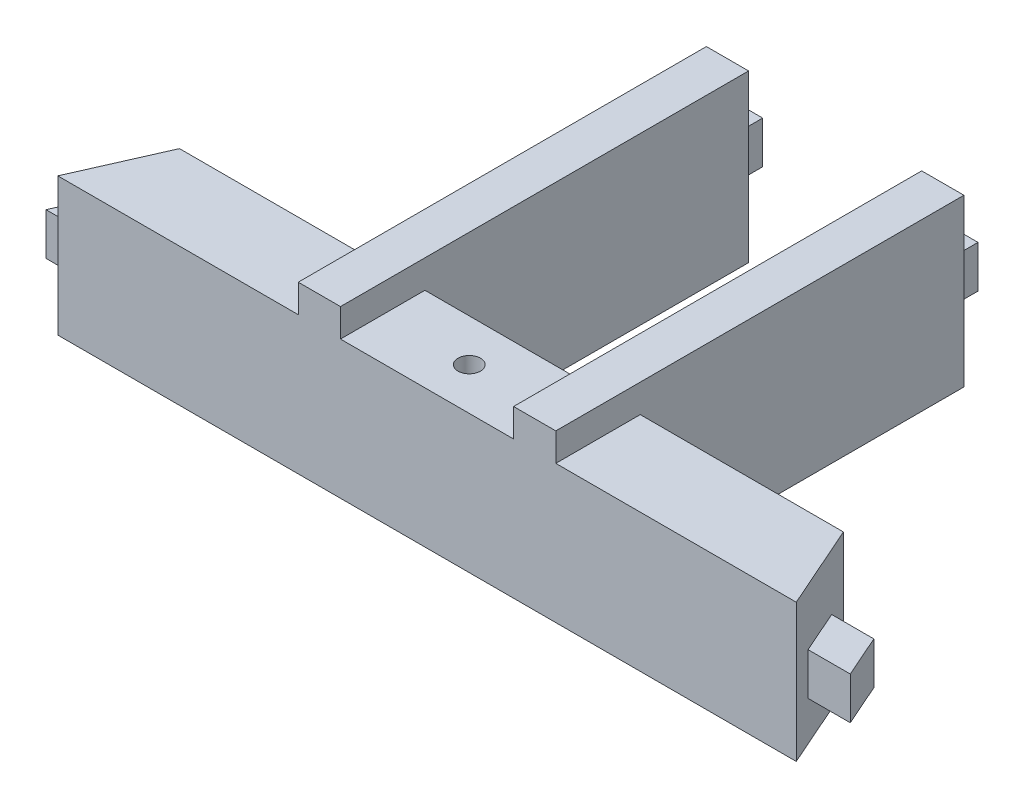
from build123d import *

# Parameters (mm, degrees)
SKETCH1_W                = 58
SKETCH1_H                = 65
BOSS_EXTRUDE1_DEPTH      = 30
BOSS_EXTRUDE3_REACH      = 92.09
SKETCH10_W               = 5
SKETCH10_H               = 14
CUT_EXTRUDE1_REACH       = 111.372
SKETCH2_R                = 2.45
SKETCH2_R_2              = 2.55
CUT_EXTRUDE2_REACH       = 91.744
SKETCH3_W                = 12.4
SKETCH3_H                = 10.4
SKETCH11_W               = 3
SKETCH11_H               = 2
BOSS_EXTRUDE4_DEPTH      = 6.3
FILLET3_R                = 1.5
SKETCH12_R               = 0.5
CUT_EXTRUDE3_DEPTH       = 92.15338732
FILLET3_OF_MIRROR1_R     = 1.5
BOSS_EXTRUDE5_REACH      = 111.564
SKETCH13_W               = 15
SKETCH13_H               = 6
BOSS_EXTRUDE6_REACH      = 111.564
SKETCH17_W               = 15
SKETCH17_H               = 14
CUT_EXTRUDE18_REACH      = 129.651
SKETCH35_W               = 16
SKETCH35_H               = 6
FILLET5_R                = 3
BOSS_EXTRUDE7_START      = 20.2
BOSS_EXTRUDE7_DEPTH      = 9.8
BOSS_EXTRUDE8_DEPTH      = 20
CUT_EXTRUDE15_REACH      = 95.637
SKETCH28_R               = 0.8
FILLET4_R                = 3
CUT_EXTRUDE16_REACH      = 96.767
SKETCH29_R               = 1.6
SKETCH30_W               = 14
SKETCH30_H               = 1.5
BOSS_EXTRUDE9_DEPTH      = 6.1
SKETCH31_W               = 1.3
SKETCH31_H               = 14
BOSS_EXTRUDE10_DEPTH     = 5
CUT_EXTRUDE17_REACH      = 99.736
FILLET11_R               = 1
FILLET11_OF_MIRROR4_R    = 1
MIRROR5_START            = 2.5
MIRROR5_OUTLINE_W        = 1.5
MIRROR5_OUTLINE_H        = 14
MIRROR5_DEPTH            = 6.1
MIRROR5_START_2          = 7.3
MIRROR5_2_DEPTH          = 1.3
SKETCH36_W               = 22.4
SKETCH36_H               = 14.8
BOSS_EXTRUDE12_DEPTH     = 14
CUT_EXTRUDE19_DEPTH      = 3
CUT_EXTRUDE20_DEPTH      = 11
CUT_EXTRUDE21_REACH      = 101.088
SKETCH41_W               = 3
SKETCH41_H               = 35
BOSS_EXTRUDE13_DEPTH     = 2
BOSS_EXTRUDE14_START     = -1.789079
SKETCH43_W               = 36.284482562
SKETCH43_H               = 9.6
BOSS_EXTRUDE14_DEPTH     = 66.789079
BOSS_EXTRUDE15_REACH     = 152.996
SKETCH44_W               = 2.842240903
SKETCH44_H               = 50
FILLET6_R                = 8
FILLET7_R                = 5
SKETCH45_W               = 17
SKETCH45_H               = 8
CUT_EXTRUDE22_DEPTH      = 166.644015889
BOSS_EXTRUDE16_REACH     = 152.29
SKETCH46_W               = 4.5
SKETCH46_H               = 5
BOSS_EXTRUDE17_REACH     = 154.715
SKETCH49_W               = 8
SKETCH49_H               = 9
CUT_EXTRUDE23_DEPTH      = 8
SKETCH50_R               = 2.45
CUT_EXTRUDE24_DEPTH      = 4.5
CUT_EXTRUDE25_START      = 13.5
SKETCH51_R               = 2.45
CUT_EXTRUDE25_DEPTH      = 4.5
BOSS_EXTRUDE18_REACH     = 165.708
SKETCH53_W               = 5
SKETCH53_H               = 10
SKETCH55_W               = 58
SKETCH55_H               = 10
BOSS_EXTRUDE20_DEPTH     = 4
CUT_EXTRUDE9_START       = -10
SKETCH19_W               = 30
SKETCH19_H               = 15
CUT_EXTRUDE9_DEPTH       = 10
SKETCH58_W               = 70
SKETCH58_H               = 9
CUT_EXTRUDE27_DEPTH      = 153.77843439
BOSS_EXTRUDE22_REACH     = 153.411
SKETCH59_W               = 30
SKETCH59_H               = 5
CUT_EXTRUDE28_REACH      = 183.113
SKETCH18_R               = 1.5
FILLET9_R                = 2
FILLET10_R               = 1
SKETCH60_W               = 70
SKETCH60_H               = 3
BOSS_EXTRUDE23_DEPTH     = 30
CUT_EXTRUDE29_DEPTH      = 7.5
CUT_EXTRUDE30_DEPTH      = 3
SKETCH64_W               = 58
SKETCH64_H               = 4
BOSS_EXTRUDE24_DEPTH     = 6
CUT_EXTRUDE31_DEPTH      = 7.5
CUT_EXTRUDE32_DEPTH      = 153.77843439
SKETCH66_W               = 26.284482562
SKETCH66_H               = 4.8
BOSS_EXTRUDE25_DEPTH     = 10
SKETCH73_W               = 121.646596119
SKETCH73_H               = 145.231140265
CUT_EXTRUDE33_DEPTH      = 16
CUT_EXTRUDE34_DEPTH      = 4
CUT_EXTRUDE35_DEPTH      = 6.5
CUT_EXTRUDE36_DEPTH      = 7
SKETCH79_W               = 43.755200993
SKETCH79_H               = 6.87148653
CUT_EXTRUDE37_DEPTH      = 2
CUT_EXTRUDE38_DEPTH      = 2.4
CUT_EXTRUDE39_DEPTH      = 108.707547785
CUT_EXTRUDE39_DEPTH_BACK = 108.707547785
SKETCH81_W               = 95.744118352
SKETCH81_H               = 138.331599567
BOSS_EXTRUDE26_START     = -2.8
BOSS_EXTRUDE26_DEPTH     = 3
SKETCH83_W               = 1
SKETCH83_H               = 3
BOSS_EXTRUDE27_DEPTH     = 2


# Read off the part's stored shape, not the designer's step: Mirror5
# Some blends are built 0.0001 mm under size
with BuildPart() as part:
    # Sketch1 → Boss-Extrude1 (new body)
    with BuildSketch(Plane(origin=(0, 0, 0), x_dir=(1, 0, 0), z_dir=(0, 1, 0))):
        Polygon((-35, 38.5), (-17.352941176, 78.5), (17.352941947, 78.5), (35, 38.5), (35, -38.5), (-35, -38.5), align=None)
        Rectangle(SKETCH1_W, SKETCH1_H, mode=Mode.SUBTRACT)
        Polygon((-28.44203382, 38.5), (28.442033867, 38.5), (13.442034522, 72.5), (-13.44203382, 72.5), align=None, mode=Mode.SUBTRACT)
    extrude(amount=BOSS_EXTRUDE1_DEPTH)

    # Sketch7 → Loft3 section 0
    with BuildSketch(Plane.XY.offset(-32.5)):
        with BuildLine():
            Line((-8.6, 30), (8.6, 30))
            Line((8.6, 30), (8.6, 27))
            Line((8.6, 27), (-8.6, 27))
            Line((-8.6, 27), (-8.6, 30))
        make_face()
    # Sketch8 → Loft3 section 1
    with BuildSketch(Plane.XY.offset(38.5)):
        with BuildLine():
            Line((-8.6, 30), (8.6, 30))
            Line((8.6, 30), (8.6, 27))
            Line((8.6, 27), (-8.6, 27))
            Line((-8.6, 27), (-8.6, 30))
        make_face()
    loft3 = loft()

    # Mirror3: Loft3 across plane
    add(loft3.mirror(Plane(origin=(0, 15, 0), x_dir=(0, 0, 1), z_dir=(0, -1, 0))))

    # Sketch10 → Boss-Extrude3 (add, up to next)
    with BuildSketch(Plane.XZ.offset(-27), mode=Mode.PRIVATE) as boss_extrude3_sk1:
        with Locations((0, 2.5)):
            Rectangle(SKETCH10_W, SKETCH10_H)
    boss_extrude3_tool1 = extrude(boss_extrude3_sk1.sketch, amount=BOSS_EXTRUDE3_REACH, mode=Mode.PRIVATE) - part.part
    add(boss_extrude3_tool1.solids().sort_by_distance((0, 27, 2.5))[0])

    # Sketch2 → Cut-Extrude1 (cut, up to next)
    with BuildSketch(Plane(origin=(35, 0, 0), x_dir=(0, 0, -1), z_dir=(1, 0, 0)), mode=Mode.PRIVATE) as cut_extrude1_sk1:
        with Locations((-2.5, 15)):
            Circle(SKETCH2_R)
    cut_extrude1_tool1 = extrude(cut_extrude1_sk1.sketch, amount=-CUT_EXTRUDE1_REACH, mode=Mode.PRIVATE) & part.part
    # Sketch2 → Cut-Extrude1 (cut, up to next)
    with BuildSketch(Plane(origin=(35, 0, 0), x_dir=(0, 0, -1), z_dir=(1, 0, 0)), mode=Mode.PRIVATE) as cut_extrude1_sk2:
        with Locations((19.5, 15)):
            Circle(SKETCH2_R_2)
    cut_extrude1_tool2 = extrude(cut_extrude1_sk2.sketch, amount=-CUT_EXTRUDE1_REACH, mode=Mode.PRIVATE) & part.part
    cut_extrude1_1 = cut_extrude1_tool1.solids().sort_by_distance((35, 15, 2.5))[0]
    add(cut_extrude1_1, mode=Mode.SUBTRACT)
    cut_extrude1_2 = cut_extrude1_tool2.solids().sort_by_distance((35, 15, -19.5))[0]
    add(cut_extrude1_2, mode=Mode.SUBTRACT)
    cut_extrude1 = cut_extrude1_1 + cut_extrude1_2  # Cut-Extrude1 as one shape, for the pattern or mirror that repeats it

    # Sketch3 → Cut-Extrude2 (cut, up to next)
    with BuildSketch(Plane(origin=(0, 0, -38.5), x_dir=(-1, 0, 0), z_dir=(0, 0, -1)), mode=Mode.PRIVATE) as cut_extrude2_sk1:
        with Locations((0, 15)):
            Rectangle(SKETCH3_W, SKETCH3_H)
    cut_extrude2_tool1 = extrude(cut_extrude2_sk1.sketch, amount=-CUT_EXTRUDE2_REACH, mode=Mode.PRIVATE) & part.part
    add(cut_extrude2_tool1.solids().sort_by_distance((0, 15, -38.5))[0], mode=Mode.SUBTRACT)

    # Sketch11 → Boss-Extrude4 (add)
    with BuildSketch(Plane(origin=(35, 0, 0), x_dir=(0, 0, -1), z_dir=(1, 0, 0))):
        with Locations((2.5, 20)):
            Rectangle(SKETCH11_W, SKETCH11_H)
        with Locations((2.5, 10)):
            Rectangle(SKETCH11_W, SKETCH11_H)
    boss_extrude4 = extrude(amount=BOSS_EXTRUDE4_DEPTH)

    # Fillet3
    fillet3_edges = [part.edges().sort_by_distance(p)[0] for p in [
        (41.3, 10, -1),
        (41.3, 10, -4),
        (41.3, 20, -1),
        (41.3, 20, -4),
    ]]
    fillet(fillet3_edges, radius=FILLET3_R - 0.0001)  # a hair under: the kernel refuses the full size

    # Sketch12 → Cut-Extrude3 (cut, through all)
    with BuildSketch(Plane(origin=(0, 21, 0), x_dir=(1, 0, 0), z_dir=(0, 1, 0))):
        with Locations(Location((39.8, 2.5, 0), (0, 0, 270))):
            Circle(SKETCH12_R)
    cut_extrude3 = extrude(amount=-CUT_EXTRUDE3_DEPTH, mode=Mode.SUBTRACT)

    # Mirror1: Cut-Extrude1, Boss-Extrude4, Cut-Extrude3 across plane
    add(cut_extrude1.mirror(Plane(origin=(0, 0, 0), x_dir=(0, 0, 1), z_dir=(1, 0, 0))), mode=Mode.SUBTRACT)
    add(boss_extrude4.mirror(Plane(origin=(0, 0, 0), x_dir=(0, 0, 1), z_dir=(1, 0, 0))))
    add(cut_extrude3.mirror(Plane(origin=(0, 0, 0), x_dir=(0, 0, 1), z_dir=(1, 0, 0))), mode=Mode.SUBTRACT)

    # Fillet3 of Mirror1
    fillet3_of_mirror1_edges = [part.edges().sort_by_distance(p)[0] for p in [
        (-41.3, 10, -1),
        (-41.3, 10, -4),
        (-41.3, 20, -1),
        (-41.3, 20, -4),
    ]]
    fillet(fillet3_of_mirror1_edges, radius=FILLET3_OF_MIRROR1_R - 0.0001)  # a hair under: the kernel refuses the full size

    # Sketch13 → Boss-Extrude5 (add, up to next)
    with BuildSketch(Plane(origin=(-29, 0, 0), x_dir=(0, 0, -1), z_dir=(1, 0, 0)), mode=Mode.PRIVATE) as boss_extrude5_sk1:
        with Locations((-25, 27)):
            Rectangle(SKETCH13_W, SKETCH13_H)
    boss_extrude5_tool1 = extrude(boss_extrude5_sk1.sketch, amount=BOSS_EXTRUDE5_REACH, mode=Mode.PRIVATE) - part.part
    add(boss_extrude5_tool1.solids().sort_by_distance((-29, 27, 25))[0])

    # Sketch17 → Boss-Extrude6 (add, up to next)
    with BuildSketch(Plane(origin=(-29, 0, 0), x_dir=(0, 0, -1), z_dir=(1, 0, 0)), mode=Mode.PRIVATE) as boss_extrude6_sk1:
        with Locations((-25, 7)):
            Rectangle(SKETCH17_W, SKETCH17_H)
    boss_extrude6_tool1 = extrude(boss_extrude6_sk1.sketch, amount=BOSS_EXTRUDE6_REACH, mode=Mode.PRIVATE) - part.part
    add(boss_extrude6_tool1.solids().sort_by_distance((-29, 7, 25))[0])

    # Sketch35 → Cut-Extrude18 (cut, up to next)
    with BuildSketch(Plane(origin=(0, 0, -78.5), x_dir=(-1, 0, 0), z_dir=(0, 0, -1)), mode=Mode.PRIVATE) as cut_extrude18_sk1:
        with Locations((0, 15)):
            Rectangle(SKETCH35_W, SKETCH35_H)
    cut_extrude18_tool1 = extrude(cut_extrude18_sk1.sketch, amount=-CUT_EXTRUDE18_REACH, mode=Mode.PRIVATE) & part.part
    add(cut_extrude18_tool1.solids().sort_by_distance((0, 15, -78.5))[0], mode=Mode.SUBTRACT)

    # Fillet5
    fillet5_edges = [part.edges().sort_by_distance(p)[0] for p in [
        (-35, 15, -38.5),
        (-17.352941176, 15, -78.5),
        (17.352941947, 15, -78.5),
        (35, 15, -38.5),
        (-8, 15, -78.5),
        (8, 15, -78.5),
    ]]
    fillet(fillet5_edges, radius=FILLET5_R)

    # Sketch24 → Boss-Extrude7 (add)
    with BuildSketch(Plane(origin=(0, 0, 0), x_dir=(1, 0, 0), z_dir=(0, 1, 0)).offset(BOSS_EXTRUDE7_START)):
        Polygon((9.15, 49.5), (9.15, 72.5), (6.15, 72.5), (6.15, 49.5), (-6.15, 49.5), (-6.15, 72.5), (-9.15, 72.5), (-9.15, 49.5), (-23.589092644, 49.5), (-26.23615161, 43.5), (26.23615161, 43.5), (23.589092902, 49.5), align=None)
    extrude(amount=BOSS_EXTRUDE7_DEPTH)

    # Sketch26 → Boss-Extrude8 (add)
    with BuildSketch(Plane(origin=(0, 0, -38.5), x_dir=(-1, 0, 0), z_dir=(0, 0, -1))):
        Polygon((-11.2, 4.8), (-11.2, 0), (11.2, 0), (11.2, 4.8), (11.2, 14.8), (6.2, 14.8), (6.2, 9.8), (-6.2, 9.8), (-6.2, 14.8), (-11.2, 14.8), align=None)
    extrude(amount=BOSS_EXTRUDE8_DEPTH)

    # Sketch28 → Cut-Extrude15 (cut, up to next)
    with BuildSketch(Plane(origin=(0, 30, 0), x_dir=(-1, 0, 0), z_dir=(0, 1, 0)), mode=Mode.PRIVATE) as cut_extrude15_sk1:
        with Locations(Location((0, -46.5, 0), (0, 0, 90))):
            Circle(SKETCH28_R)
    cut_extrude15_tool1 = extrude(cut_extrude15_sk1.sketch, amount=-CUT_EXTRUDE15_REACH, mode=Mode.PRIVATE) & part.part
    # Sketch28 → Cut-Extrude15 (cut, up to next)
    with BuildSketch(Plane(origin=(0, 30, 0), x_dir=(-1, 0, 0), z_dir=(0, 1, 0)), mode=Mode.PRIVATE) as cut_extrude15_sk2:
        with Locations(Location((0, -75.5, 0), (0, 0, 90))):
            Circle(SKETCH28_R)
    cut_extrude15_tool2 = extrude(cut_extrude15_sk2.sketch, amount=-CUT_EXTRUDE15_REACH, mode=Mode.PRIVATE) & part.part
    add(cut_extrude15_tool1.solids().sort_by_distance((0, 30, -46.5))[0], mode=Mode.SUBTRACT)
    add(cut_extrude15_tool2.solids().sort_by_distance((0, 30, -75.5))[0], mode=Mode.SUBTRACT)

    # Fillet4
    fillet4_edges = [part.edges().sort_by_distance(p)[0] for p in [
        (35, 19, -2.5),
        (35, 20, -4),
        (35, 21, -2.5),
        (35, 11, -2.5),
        (35, 9, -2.5),
        (35, 10, -4),
        (-35, 19, -2.5),
        (-35, 20, -4),
        (-35, 21, -2.5),
        (-35, 11, -2.5),
        (-35, 9, -2.5),
        (-35, 10, -4),
    ]]
    fillet(fillet4_edges, radius=FILLET4_R)

    # Sketch29 → Cut-Extrude16 (cut, up to next)
    with BuildSketch(Plane(origin=(2.5, 0, 0), x_dir=(0, 0, -1), z_dir=(1, 0, 0)), mode=Mode.PRIVATE) as cut_extrude16_sk1:
        with Locations(Location((-2.5, 15, 0), (0, 0, 90))):
            Circle(SKETCH29_R)
    cut_extrude16_tool1 = extrude(cut_extrude16_sk1.sketch, amount=-CUT_EXTRUDE16_REACH, mode=Mode.PRIVATE) & part.part
    add(cut_extrude16_tool1.solids().sort_by_distance((2.5, 15, 2.5))[0], mode=Mode.SUBTRACT)

    # Sketch30 → Boss-Extrude9 (add)
    with BuildSketch(Plane.ZY.offset(2.5)):
        with Locations((2.5, 26.25)):
            Rectangle(SKETCH30_W, SKETCH30_H)
    boss_extrude9 = extrude(amount=BOSS_EXTRUDE9_DEPTH)

    # Sketch31 → Boss-Extrude10 (add)
    with BuildSketch(Plane.XZ.offset(-25.5)):
        with Locations((-7.95, 2.5)):
            Rectangle(SKETCH31_W, SKETCH31_H)
    boss_extrude10 = extrude(amount=BOSS_EXTRUDE10_DEPTH)

    # Sketch32 → Cut-Extrude17 (cut, up to next)
    with BuildSketch(Plane.ZY.offset(8.6), mode=Mode.PRIVATE) as cut_extrude17_sk1:
        with BuildLine():
            Line((-4.5, 20.5), (-4.5, 20.656854249))
            ThreePointArc((-4.5, 20.656854249), (2.5, 24), (9.5, 20.656854249))
            Line((9.5, 20.656854249), (9.5, 20.5))
            Line((9.5, 20.5), (-4.5, 20.5))
        make_face()
    cut_extrude17_tool1 = extrude(cut_extrude17_sk1.sketch, amount=-CUT_EXTRUDE17_REACH, mode=Mode.PRIVATE) & part.part
    cut_extrude17 = cut_extrude17_tool1.solids().sort_by_distance((-8.6, 21.927092, 2.5))[0]
    add(cut_extrude17, mode=Mode.SUBTRACT)

    # Fillet11
    fillet11_edges = [part.edges().sort_by_distance(p)[0] for p in [
        (-7.95, 20.656854249, 9.5),
        (-7.95, 20.656854249, -4.5),
    ]]
    fillet(fillet11_edges, radius=FILLET11_R)

    # Mirror4: Boss-Extrude9, Boss-Extrude10, Cut-Extrude17 across plane
    add(boss_extrude9.mirror(Plane(origin=(0, 15, 0), x_dir=(0, 0, 1), z_dir=(0, -1, 0))))
    add(boss_extrude10.mirror(Plane(origin=(0, 15, 0), x_dir=(0, 0, 1), z_dir=(0, -1, 0))))
    add(cut_extrude17.mirror(Plane(origin=(0, 15, 0), x_dir=(0, 0, 1), z_dir=(0, -1, 0))), mode=Mode.SUBTRACT)

    # Fillet11 of Mirror4
    fillet11_of_mirror4_edges = [part.edges().sort_by_distance(p)[0] for p in [
        (-7.95, 9.343145751, 9.5),
        (-7.95, 9.343145751, -4.5),
    ]]
    fillet(fillet11_of_mirror4_edges, radius=FILLET11_OF_MIRROR4_R)

    # Mirror5 outline → Mirror5 (add)
    with BuildSketch(Plane.YZ.offset(MIRROR5_START)):
        with Locations((3.75, 2.5)):
            Rectangle(MIRROR5_OUTLINE_W, MIRROR5_OUTLINE_H)
        with Locations((26.25, 2.5)):
            Rectangle(MIRROR5_OUTLINE_W, MIRROR5_OUTLINE_H)
    extrude(amount=MIRROR5_DEPTH)

    # Mirror5 2 outline → Mirror5 2 (add)
    with BuildSketch(Plane.YZ.offset(MIRROR5_START_2)):
        with BuildLine():
            Line((7, 9.5), (4.5, 9.5))
            Line((4.5, 9.5), (4.5, -4.5))
            Line((4.5, -4.5), (7, -4.5))
            ThreePointArc((7, -4.5), (7.894427191, -3.947213595), (7.8, -2.9))
            ThreePointArc((7.8, -2.9), (6, 2.5), (7.8, 7.9))
            ThreePointArc((7.8, 7.9), (7.894427191, 8.947213595), (7, 9.5))
        make_face()
        with BuildLine():
            Line((25.5, 9.5), (23, 9.5))
            ThreePointArc((23, 9.5), (22.105572809, 8.947213595), (22.2, 7.9))
            ThreePointArc((22.2, 7.9), (24, 2.5), (22.2, -2.9))
            ThreePointArc((22.2, -2.9), (22.105572809, -3.947213595), (23, -4.5))
            Line((23, -4.5), (25.5, -4.5))
            Line((25.5, -4.5), (25.5, 9.5))
        make_face()
    extrude(amount=MIRROR5_2_DEPTH)

    # Sketch36 → Boss-Extrude12 (add)
    with BuildSketch(Plane(origin=(0, 0, -58.5), x_dir=(-1, 0, 0), z_dir=(0, 0, -1))):
        with Locations((0, 7.4)):
            Rectangle(SKETCH36_W, SKETCH36_H)
    extrude(amount=BOSS_EXTRUDE12_DEPTH)

    # Sketch37 → Cut-Extrude19 (cut)
    with BuildSketch(Plane.XY.offset(-58.5)):
        with BuildLine():
            Line((-6, 14.8), (6, 14.8))
            ThreePointArc((6, 14.8), (5.340169944, 12.004915028), (3.5, 9.8))
            Line((3.5, 9.8), (-3.5, 9.8))
            ThreePointArc((-3.5, 9.8), (-5.340169944, 12.004915028), (-6, 14.8))
        make_face()
    extrude(amount=-CUT_EXTRUDE19_DEPTH, mode=Mode.SUBTRACT)

    # Sketch38 → Cut-Extrude20 (cut)
    with BuildSketch(Plane.XY.offset(-61.5)):
        with BuildLine():
            Line((-6, 14.8), (6, 14.8))
            ThreePointArc((6, 14.8), (0, 11.8), (-6, 14.8))
        make_face()
    extrude(amount=-CUT_EXTRUDE20_DEPTH, mode=Mode.SUBTRACT)

    # Cut-Extrude21: up to this face of the body (flat: up to its plane)
    cut_extrude21_end = Plane(part.part.faces().sort_by_distance((11.2, 7.4, -55.5))[0])
    # Sketch40 → Cut-Extrude21 (cut, up to the picked face)
    with BuildSketch(Plane.ZY.offset(11.2), mode=Mode.PRIVATE) as cut_extrude21_sk1:
        Polygon((-58.5, 14.8), (-72.5, 14.8), (-72.5, 11.8), align=None)
    cut_extrude21_tool1 = split(extrude(cut_extrude21_sk1.sketch, amount=-CUT_EXTRUDE21_REACH, mode=Mode.PRIVATE), bisect_by=cut_extrude21_end, keep=Keep.BOTH, mode=Mode.PRIVATE)
    add(cut_extrude21_tool1.solids().sort_by(Axis((-11.2, 13.8, -67.833333), (1, 0, 0)))[0], mode=Mode.SUBTRACT)

    # Sketch41 → Boss-Extrude13 (add)
    with BuildSketch(Plane(origin=(0, 30, 0), x_dir=(1, 0, 0), z_dir=(0, 1, 0))):
        with Locations((-7.65, 61)):
            Rectangle(SKETCH41_W, SKETCH41_H)
        with Locations((7.65, 61)):
            Rectangle(SKETCH41_W, SKETCH41_H)
    extrude(amount=BOSS_EXTRUDE13_DEPTH)

    # Sketch43 → Boss-Extrude14 (add)
    with BuildSketch(Plane(origin=(0, 0, -78.5), x_dir=(-1, 0, 0), z_dir=(0, 0, -1)).offset(BOSS_EXTRUDE14_START)):
        with Locations((-3.78e-07, 4.8)):
            Rectangle(SKETCH43_W, SKETCH43_H)
        with Locations((-3.78e-07, 25.2)):
            Rectangle(SKETCH43_W, SKETCH43_H)
    extrude(amount=BOSS_EXTRUDE14_DEPTH)

    # Sketch44 → Boss-Extrude15 (add, up to next)
    with BuildSketch(Plane(origin=(0, 9.6, 0), x_dir=(1, 0, 0), z_dir=(0, 1, 0)), mode=Mode.PRIVATE) as boss_extrude15_sk1:
        with Locations((-16.721120451, 118.5)):
            Rectangle(SKETCH44_W, SKETCH44_H)
    boss_extrude15_tool1 = extrude(boss_extrude15_sk1.sketch, amount=BOSS_EXTRUDE15_REACH, mode=Mode.PRIVATE) - part.part
    # Sketch44 → Boss-Extrude15 (add, up to next)
    with BuildSketch(Plane(origin=(0, 9.6, 0), x_dir=(1, 0, 0), z_dir=(0, 1, 0)), mode=Mode.PRIVATE) as boss_extrude15_sk2:
        Polygon((18.142241659, 143.5), (15.3, 143.5), (15.3, 93.5), (18.142240903, 93.5), align=None)
    boss_extrude15_tool2 = extrude(boss_extrude15_sk2.sketch, amount=BOSS_EXTRUDE15_REACH, mode=Mode.PRIVATE) - part.part
    add(boss_extrude15_tool1.solids().sort_by_distance((-16.72112, 9.6, -118.5))[0])
    add(boss_extrude15_tool2.solids().sort_by_distance((16.721121, 9.6, -118.500001))[0])

    # Fillet6
    fillet6_edges = [part.edges().sort_by_distance(p)[0] for p in [
        (3.78e-07, 0, -143.5),
        (3.78e-07, 30, -143.5),
    ]]
    fillet(fillet6_edges, radius=FILLET6_R)

    # Fillet7
    # the kernel refuses this fillet: 5 mm, written as the material it takes off along each edge
    with BuildSketch(Plane(origin=(18.142241659, 0, -64.210921), x_dir=(-1, 0, 0), z_dir=(0, 0, -1))) as fillet7_piece_1_section:
        with BuildLine():
            CenterArc((FILLET7_R, FILLET7_R), FILLET7_R, 180, 90)
            Line((0, FILLET7_R), (0, 0))
            Line((0, 0), (FILLET7_R, 0))
        make_face()
    fillet7_piece_1 = extrude(amount=71.289079, mode=Mode.PRIVATE)
    fillet7_piece_1 = split(fillet7_piece_1, bisect_by=Plane(origin=(6.655944686, 1.159648817, -102.746528186), z_dir=(0.9149178080838143, 0, -0.4036401918182936)), keep=Keep.TOP, mode=Mode.PRIVATE)
    with BuildSketch(Plane(origin=(18.142241659, 8, -135.5), x_dir=(0, -1, 0), z_dir=(0, 0, 1))) as fillet7_piece_2:
        with BuildLine():
            CenterArc((8 - FILLET7_R, -FILLET7_R), FILLET7_R, 0, 90)
            Line((8 - FILLET7_R, 0), (8, 0))
            Line((8, 0), (8, -FILLET7_R))
        make_face()
    fillet7_piece_2_solid = revolve(axis=Axis((18.142241659, 8, -135.5), (1, 0, 0)), revolution_arc=90, mode=Mode.PRIVATE)
    with BuildSketch(Plane(origin=(18.142241659, 9.6, -143.5), x_dir=(-1, 0, 0), z_dir=(0, 1, 0))) as fillet7_piece_3:
        with BuildLine():
            CenterArc((FILLET7_R * 1.00000001512, FILLET7_R), FILLET7_R, 179.999999134, 90.000000866)
            Line((FILLET7_R * 1.511713279e-08, FILLET7_R * 1.00000001512), (0, 0))
            Line((0, 0), (FILLET7_R * 1.00000001512, 0))
        make_face()
    fillet7_piece_3_solid = extrude(amount=10.8, mode=Mode.PRIVATE)
    with BuildSketch(Plane(origin=(18.142241659, 22, -135.5), x_dir=(0, 1, 0), z_dir=(0, 0, 1))) as fillet7_piece_4:
        with BuildLine():
            CenterArc((8 - FILLET7_R, FILLET7_R), FILLET7_R, 270, 90)
            Line((8 - FILLET7_R, 0), (8, 0))
            Line((8, 0), (8, FILLET7_R))
        make_face()
    fillet7_piece_4_solid = revolve(axis=Axis((18.142241659, 22, -135.5), (-1, 0, 0)), revolution_arc=90, mode=Mode.PRIVATE)
    with BuildSketch(Plane(origin=(-18.142240903, 0, -64.210921), x_dir=(0, 1, 0), z_dir=(0, 0, -1))) as fillet7_piece_5_section:
        with BuildLine():
            CenterArc((FILLET7_R, FILLET7_R), FILLET7_R, 180, 90)
            Line((0, FILLET7_R), (0, 0))
            Line((0, 0), (FILLET7_R, 0))
        make_face()
    fillet7_piece_5 = extrude(amount=71.289079, mode=Mode.PRIVATE)
    fillet7_piece_5 = split(fillet7_piece_5, bisect_by=Plane(origin=(-6.655943611, 1.159648816, -102.746527816), z_dir=(-0.914917801572932, 0, -0.40364020657629374)), keep=Keep.TOP, mode=Mode.PRIVATE)
    with BuildSketch(Plane(origin=(-18.142240903, 8, -135.5), x_dir=(0, -1, 0), z_dir=(0, 0, 1))) as fillet7_piece_6:
        with BuildLine():
            CenterArc((8 - FILLET7_R, FILLET7_R), FILLET7_R, 270, 90)
            Line((8, FILLET7_R), (8, 0))
            Line((8, 0), (8 - FILLET7_R, 0))
        make_face()
    fillet7_piece_6_solid = revolve(axis=Axis((-18.142240903, 8, -135.5), (1, 0, 0)), revolution_arc=90, mode=Mode.PRIVATE)
    with BuildSketch(Plane(origin=(-18.142240903, 22, -143.5), x_dir=(0, 0, 1), z_dir=(0, -1, 0))) as fillet7_piece_7:
        with BuildLine():
            CenterArc((FILLET7_R, -FILLET7_R), FILLET7_R, 90, 90)
            Line((0, -FILLET7_R), (0, 0))
            Line((0, 0), (FILLET7_R, 0))
        make_face()
    fillet7_piece_7_solid = extrude(amount=14, mode=Mode.PRIVATE)
    with BuildSketch(Plane(origin=(-18.142240903, 22, -135.5), x_dir=(0, 1, 0), z_dir=(0, 0, 1))) as fillet7_piece_8:
        with BuildLine():
            CenterArc((8 - FILLET7_R, -FILLET7_R), FILLET7_R, 0, 90)
            Line((8, -FILLET7_R), (8, 0))
            Line((8, 0), (8 - FILLET7_R, 0))
        make_face()
    fillet7_piece_8_solid = revolve(axis=Axis((-18.142240903, 22, -135.5), (-1, 0, 0)), revolution_arc=90, mode=Mode.PRIVATE)
    with BuildSketch(Plane(origin=(18.142241659, 30, -64.210921), x_dir=(-1, 0, 0), z_dir=(0, 0, -1))) as fillet7_piece_9_section:
        with BuildLine():
            CenterArc((FILLET7_R, -FILLET7_R), FILLET7_R, 90, 90)
            Line((0, -FILLET7_R), (0, 0))
            Line((0, 0), (FILLET7_R, 0))
        make_face()
    fillet7_piece_9 = extrude(amount=71.289079, mode=Mode.PRIVATE)
    fillet7_piece_9 = split(fillet7_piece_9, bisect_by=Plane(origin=(6.655944686, 28.840351183, -102.746528186), z_dir=(0.9149178080838143, 0, -0.4036401918182936)), keep=Keep.TOP, mode=Mode.PRIVATE)
    with BuildSketch(Plane(origin=(-18.142240903, 30, -64.210921), x_dir=(1, 0, 0), z_dir=(0, 0, -1))) as fillet7_piece_10_section:
        with BuildLine():
            CenterArc((FILLET7_R, FILLET7_R), FILLET7_R, 180, 90)
            Line((0, FILLET7_R), (0, 0))
            Line((0, 0), (FILLET7_R, 0))
        make_face()
    fillet7_piece_10 = extrude(amount=71.289079, mode=Mode.PRIVATE)
    fillet7_piece_10 = split(fillet7_piece_10, bisect_by=Plane(origin=(-6.655943611, 28.840351184, -102.746527816), z_dir=(-0.914917801572932, 0, -0.40364020657629374)), keep=Keep.TOP, mode=Mode.PRIVATE)
    with BuildSketch(Plane(origin=(18.142241659, 20.4, -143.5), x_dir=(0, 0, 1), z_dir=(0, 1, 0)), Plane(origin=(18.142241659, 9.6, -143.5), x_dir=(-1, 0, 0), z_dir=(0, -1, 0))) as fillet7_piece_11:
        with BuildLine():
            CenterArc((FILLET7_R, -FILLET7_R), FILLET7_R, 90, 90)
            Line((0, -FILLET7_R), (0, 0))
            Line((0, 0), (FILLET7_R, 0))
        make_face()
    fillet7_piece_11_solid = extrude(amount=1.6, mode=Mode.PRIVATE)
    add([fillet7_piece_1, fillet7_piece_2_solid, fillet7_piece_3_solid, fillet7_piece_4_solid, fillet7_piece_5, fillet7_piece_6_solid, fillet7_piece_7_solid, fillet7_piece_8_solid, fillet7_piece_9, fillet7_piece_10, fillet7_piece_11_solid], mode=Mode.SUBTRACT)

    # Sketch45 → Cut-Extrude22 (cut, through all)
    with BuildSketch(Plane(origin=(35, 0, 0), x_dir=(0, 0, -1), z_dir=(1, 0, 0))):
        with Locations((-24, 19)):
            Rectangle(SKETCH45_W, SKETCH45_H)
    extrude(amount=-CUT_EXTRUDE22_DEPTH, mode=Mode.SUBTRACT)

    # Sketch46 → Boss-Extrude16 (add, up to next)
    with BuildSketch(Plane(origin=(0, 15, 0), x_dir=(1, 0, 0), z_dir=(0, 1, 0)), mode=Mode.PRIVATE) as boss_extrude16_sk1:
        with Locations((31.25, -30)):
            Rectangle(SKETCH46_W, SKETCH46_H)
    boss_extrude16_tool1 = extrude(boss_extrude16_sk1.sketch, amount=BOSS_EXTRUDE16_REACH, mode=Mode.PRIVATE) - part.part
    boss_extrude16 = boss_extrude16_tool1.solids().sort_by_distance((31.25, 15, 30))[0]
    add(boss_extrude16)

    # Boss-Extrude17: up to this face of the body (flat: up to its plane)
    boss_extrude17_end = Plane(part.part.faces().sort_by_distance((-6.013146063, 30, -46.5))[0])
    # Sketch48 → Boss-Extrude17 (add, up to the picked face)
    with BuildSketch(Plane.XZ, mode=Mode.PRIVATE) as boss_extrude17_sk1:
        with BuildLine():
            Line((35, 29.5), (39, 29.5))
            ThreePointArc((39, 29.5), (43, 25.5), (39, 21.5))
            Line((39, 21.5), (35, 21.5))
            Line((35, 21.5), (35, 29.5))
        make_face()
    boss_extrude17_tool1 = split(extrude(boss_extrude17_sk1.sketch, amount=-BOSS_EXTRUDE17_REACH, mode=Mode.PRIVATE), bisect_by=boss_extrude17_end, keep=Keep.BOTH, mode=Mode.PRIVATE)
    boss_extrude17 = boss_extrude17_tool1.solids().sort_by(Axis((38.626601, 0, 25.5), (0, 1, 0)))[0]
    add(boss_extrude17)

    # Sketch49 → Cut-Extrude23 (cut)
    with BuildSketch(Plane.XY.offset(29.5)):
        with Locations((39, 19)):
            Rectangle(SKETCH49_W, SKETCH49_H)
    cut_extrude23 = extrude(amount=-CUT_EXTRUDE23_DEPTH, mode=Mode.SUBTRACT)

    # Sketch50 → Cut-Extrude24 (cut)
    with BuildSketch(Plane(origin=(0, 14.5, 0), x_dir=(1, 0, 0), z_dir=(0, 1, 0))):
        with Locations(Location((39, -25.5, 0), (0, 0, 270))):
            Circle(SKETCH50_R)
    cut_extrude24 = extrude(amount=-CUT_EXTRUDE24_DEPTH, mode=Mode.SUBTRACT)

    # Sketch51 → Cut-Extrude25 (cut)
    with BuildSketch(Plane(origin=(0, 14.5, 0), x_dir=(1, 0, 0), z_dir=(0, 1, 0)).offset(CUT_EXTRUDE25_START)):
        with Locations(Location((39, -25.5, 0), (0, 0, 270))):
            Circle(SKETCH51_R)
    cut_extrude25 = extrude(amount=-CUT_EXTRUDE25_DEPTH, mode=Mode.SUBTRACT)

    # Mirror7: Boss-Extrude16, Boss-Extrude17, Cut-Extrude23, Cut-Extrude24, Cut-Extrude25 across plane
    add(boss_extrude16.mirror(Plane(origin=(0, 0, 0), x_dir=(0, 0, 1), z_dir=(1, 0, 0))))
    add(boss_extrude17.mirror(Plane(origin=(0, 0, 0), x_dir=(0, 0, 1), z_dir=(1, 0, 0))))
    add(cut_extrude23.mirror(Plane(origin=(0, 0, 0), x_dir=(0, 0, 1), z_dir=(1, 0, 0))), mode=Mode.SUBTRACT)
    add(cut_extrude24.mirror(Plane(origin=(0, 0, 0), x_dir=(0, 0, 1), z_dir=(1, 0, 0))), mode=Mode.SUBTRACT)
    add(cut_extrude25.mirror(Plane(origin=(0, 0, 0), x_dir=(0, 0, 1), z_dir=(1, 0, 0))), mode=Mode.SUBTRACT)

    # Sketch53 → Boss-Extrude18 (add, up to next)
    with BuildSketch(Plane.ZY.offset(-29), mode=Mode.PRIVATE) as boss_extrude18_sk1:
        with Locations((30, 19)):
            Rectangle(SKETCH53_W, SKETCH53_H)
    boss_extrude18_tool1 = extrude(boss_extrude18_sk1.sketch, amount=BOSS_EXTRUDE18_REACH, mode=Mode.PRIVATE) - part.part
    add(boss_extrude18_tool1.solids().sort_by_distance((29, 19, 30))[0])

    # Sketch55 → Boss-Extrude20 (add)
    with BuildSketch(Plane(origin=(0, 0, 27.5), x_dir=(-1, 0, 0), z_dir=(0, 0, -1))):
        with Locations((0, 19)):
            Rectangle(SKETCH55_W, SKETCH55_H)
    extrude(amount=BOSS_EXTRUDE20_DEPTH)

    # Sketch19 → Cut-Extrude9 (cut)
    with BuildSketch(Plane(origin=(0, 30, 0), x_dir=(1, 0, 0), z_dir=(0, 1, 0)).offset(CUT_EXTRUDE9_START)):
        with Locations((0, -25)):
            Rectangle(SKETCH19_W, SKETCH19_H)
    extrude(amount=-CUT_EXTRUDE9_DEPTH, mode=Mode.SUBTRACT)

    # Sketch58 → Cut-Extrude27 (cut, through all)
    with BuildSketch(Plane(origin=(0, 30, 0), x_dir=(1, 0, 0), z_dir=(0, 1, 0))):
        with Locations((0, -34)):
            Rectangle(SKETCH58_W, SKETCH58_H)
    extrude(amount=-CUT_EXTRUDE27_DEPTH, mode=Mode.SUBTRACT)

    # Sketch59 → Boss-Extrude22 (add, up to next)
    with BuildSketch(Plane(origin=(0, 10, 0), x_dir=(1, 0, 0), z_dir=(0, 1, 0)), mode=Mode.PRIVATE) as boss_extrude22_sk1:
        with Locations((0, -27)):
            Rectangle(SKETCH59_W, SKETCH59_H)
    boss_extrude22_tool1 = extrude(boss_extrude22_sk1.sketch, amount=BOSS_EXTRUDE22_REACH, mode=Mode.PRIVATE) - part.part
    add(boss_extrude22_tool1.solids().sort_by_distance((0, 10, 27))[0])

    # Sketch18 → Cut-Extrude28 (cut, up to next)
    with BuildSketch(Plane.XY.offset(29.5), mode=Mode.PRIVATE) as cut_extrude28_sk1:
        with Locations((7.5, 15)):
            Circle(SKETCH18_R)
    cut_extrude28_tool1 = extrude(cut_extrude28_sk1.sketch, amount=-CUT_EXTRUDE28_REACH, mode=Mode.PRIVATE) & part.part
    # Sketch18 → Cut-Extrude28 (cut, up to next)
    with BuildSketch(Plane.XY.offset(29.5), mode=Mode.PRIVATE) as cut_extrude28_sk2:
        with Locations((-7.5, 15)):
            Circle(SKETCH18_R)
    cut_extrude28_tool2 = extrude(cut_extrude28_sk2.sketch, amount=-CUT_EXTRUDE28_REACH, mode=Mode.PRIVATE) & part.part
    add(cut_extrude28_tool1.solids().sort_by_distance((7.5, 15, 29.5))[0], mode=Mode.SUBTRACT)
    add(cut_extrude28_tool2.solids().sort_by_distance((-7.5, 15, 29.5))[0], mode=Mode.SUBTRACT)

    # Fillet9
    fillet9_edges = [part.edges().sort_by_distance(p)[0] for p in [
        (6, 15, 24.5),
        (-9, 15, 24.5),
    ]]
    fillet(fillet9_edges, radius=FILLET9_R)

    # Fillet10
    fillet10_edges = [part.edges().sort_by_distance(p)[0] for p in [
        (6, 15, 29.5),
        (-9, 15, 29.5),
    ]]
    fillet(fillet10_edges, radius=FILLET10_R)

    # Sketch60 → Boss-Extrude23 (add)
    with BuildSketch(Plane.XZ):
        with Locations((0, 31)):
            Rectangle(SKETCH60_W, SKETCH60_H)
    extrude(amount=-BOSS_EXTRUDE23_DEPTH)

    # Sketch61 → Cut-Extrude29 (cut)
    with BuildSketch(Plane.XZ):
        Polygon((11.5, 32.5), (-11.5, 32.5), (-14.5, 25), (14.5, 25), align=None)
    extrude(amount=-CUT_EXTRUDE29_DEPTH, mode=Mode.SUBTRACT)

    # Sketch62 → Cut-Extrude30 (cut)
    with BuildSketch(Plane.XY.offset(32.5)):
        with BuildLine():
            Line((-7.5, 17.5), (7.5, 17.5))
            ThreePointArc((7.5, 17.5), (10, 15), (7.5, 12.5))
            Line((7.5, 12.5), (-7.5, 12.5))
            ThreePointArc((-7.5, 12.5), (-10, 15), (-7.5, 17.5))
        make_face()
    extrude(amount=-CUT_EXTRUDE30_DEPTH, mode=Mode.SUBTRACT)

    # Sketch64 → Boss-Extrude24 (add)
    with BuildSketch(Plane(origin=(0, 0, 23.5), x_dir=(-1, 0, 0), z_dir=(0, 0, -1))):
        with Locations((0, 22)):
            Rectangle(SKETCH64_W, SKETCH64_H)
    extrude(amount=BOSS_EXTRUDE24_DEPTH)

    # Sketch63 → Cut-Extrude31 (cut)
    with BuildSketch(Plane(origin=(0, 30, 0), x_dir=(1, 0, 0), z_dir=(0, 1, 0))):
        Polygon((-11.5, -32.5), (11.5, -32.5), (14.5, -25), (-14.5, -25), align=None)
    extrude(amount=-CUT_EXTRUDE31_DEPTH, mode=Mode.SUBTRACT)

    # Sketch65 → Cut-Extrude32 (cut, through all)
    with BuildSketch(Plane(origin=(0, 30, 0), x_dir=(1, 0, 0), z_dir=(0, 1, 0))):
        Polygon((-13.142240903, 88.044253953), (13.142241659, 88.044254404), (18.142241659, 76.710920576), (18.142241659, 143.5), (-18.142240903, 143.5), (-18.142240903, 76.71092062), align=None)
    extrude(amount=-CUT_EXTRUDE32_DEPTH, mode=Mode.SUBTRACT)

    # Sketch66 → Boss-Extrude25 (add)
    with BuildSketch(Plane(origin=(-1.51e-06, 0, -88.044254178), x_dir=(-0.9999999999999999, 0, 1.7148916448299635e-08), z_dir=(-1.7148916448299635e-08, 0, -0.9999999999999999))):
        with Locations((-1.888e-06, 27.6)):
            Rectangle(SKETCH66_W, SKETCH66_H)
        with Locations((-1.888e-06, 2.4)):
            Rectangle(SKETCH66_W, SKETCH66_H)
    extrude(amount=BOSS_EXTRUDE25_DEPTH)

    # Sketch73 → Cut-Extrude33 (cut)
    with BuildSketch(Plane.XZ):
        with Locations((0.620645899, -33.237611814)):
            Rectangle(SKETCH73_W, SKETCH73_H)
    extrude(amount=-CUT_EXTRUDE33_DEPTH, mode=Mode.SUBTRACT)

    # Sketch75 → Cut-Extrude34 (cut)
    with BuildSketch(Plane.XZ.offset(-16)):
        Polygon((-2.5, -7), (8.6, -7), (8.6, 23.5), (29, 23.5), (29, 24.5), (8.6, 24.5), (-8.6, 24.5), (-29, 24.5), (-29, 23.5), (-8.6, 23.5), (-8.6, -7), align=None)
    extrude(amount=-CUT_EXTRUDE34_DEPTH, mode=Mode.SUBTRACT)

    # Sketch76 → Cut-Extrude35 (cut)
    with BuildSketch(Plane.XZ.offset(-16)):
        Polygon((-24.977236043, 32.5), (25, 32.5), (25, 24.5), (13.214480845, 24.5), (-24.977236043, 24.5), align=None)
    extrude(amount=-CUT_EXTRUDE35_DEPTH, mode=Mode.SUBTRACT)

    # Sketch78 → Cut-Extrude36 (cut)
    with BuildSketch(Plane.XZ.offset(-16)):
        Polygon((-24.977236043, 32.5), (-35, 32.5), (-35, -1), (-29, -1), (-29, 17.5), (-29, 24.5), (-24.977236043, 24.5), align=None)
        Polygon((-35, -7), (-29, -7), (-29, -32.5), (29, -32.5), (29, -7), (35, -7), (35, -76.71092062), (18.142240903, -76.71092062), (8, -76.71092062), (8, -72.5), (13.44203382, -72.5), (28.44203382, -38.5), (-28.44203382, -38.5), (-13.44203382, -72.5), (-8, -72.5), (-8, -76.71092062), (-18.142240903, -76.71092062), (-35, -76.71092062), align=None)
        Polygon((35, -1), (29, -1), (29, 24.5), (25, 24.5), (24.977236043, 32.5), (35, 32.5), align=None)
    extrude(amount=-CUT_EXTRUDE36_DEPTH, mode=Mode.SUBTRACT)

    # Sketch79 → Cut-Extrude37 (cut)
    with BuildSketch(Plane.XZ.offset(-16)):
        with Locations((0.386040845, -77.09592916)):
            Rectangle(SKETCH79_W, SKETCH79_H)
    extrude(amount=-CUT_EXTRUDE37_DEPTH, mode=Mode.SUBTRACT)

    # Sketch80 → Cut-Extrude38 (cut)
    with BuildSketch(Plane.XZ.offset(-18)):
        Polygon((-11.000000335, -98.04425399), (-11.000000335, -72.5), (-26.779624803, -72.5), (-26.779624803, -98.044253719), align=None)
        Polygon((26.779624803, -72.5), (11.000000335, -72.5), (11.000000335, -98.04425399), (26.779624803, -98.044253719), align=None)
    extrude(amount=-CUT_EXTRUDE38_DEPTH, mode=Mode.SUBTRACT)

    # Sketch81 → Cut-Extrude39 (cut, two sides: drawn at the far end of the back side and taken through both)
    with BuildSketch(Plane.XZ.offset(-20.2).offset(-CUT_EXTRUDE39_DEPTH_BACK)):
        with Locations((0, -31.528697094)):
            Rectangle(SKETCH81_W, SKETCH81_H)
        Polygon((-26.236151467, -43.5), (26.236151467, -43.5), (13.44203382, -72.5), (-13.44203382, -72.5), align=None, mode=Mode.SUBTRACT)
    extrude(amount=CUT_EXTRUDE39_DEPTH + CUT_EXTRUDE39_DEPTH_BACK, mode=Mode.SUBTRACT)

    # Sketch82 → Boss-Extrude26 (add)
    with BuildSketch(Plane.XZ.offset(-20.2).offset(BOSS_EXTRUDE26_START)):
        Polygon((-25.574386761, -45), (-28.574386761, -45), (-27.25085735, -48), (-24.25085735, -48), align=None)
        Polygon((25.574386761, -45), (24.25085735, -48), (27.25085735, -48), (28.574386761, -45), align=None)
    extrude(amount=-BOSS_EXTRUDE26_DEPTH)

    # Sketch83 → Boss-Extrude27 (add)
    with BuildSketch(Plane(origin=(0, 0, -72.5), x_dir=(-1, 0, 0), z_dir=(0, 0, -1))):
        with Locations((-7.65, 26.1)):
            Rectangle(SKETCH83_W, SKETCH83_H)
        with Locations((7.65, 26.1)):
            Rectangle(SKETCH83_W, SKETCH83_H)
    extrude(amount=BOSS_EXTRUDE27_DEPTH)


solid = part.part
